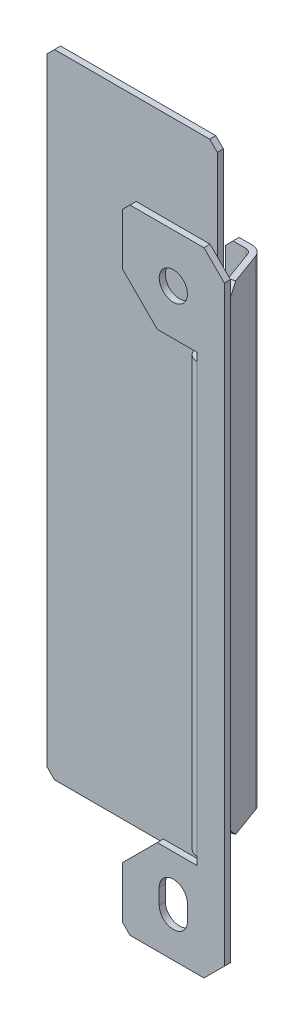
from build123d import *

# Parameters (mm, degrees)
BOSS_EXTRUDE1_DEPTH            = 62
CONVERT_SOLID1_DEPTH           = 62
CONVERT_SOLID1_2_DEPTH         = 62
CUT_EXTRUDE2_DEPTH             = 79.552402891
SKETCH9_W                      = 18.8
SKETCH9_H                      = 20
CUT_EXTRUDE3_DEPTH             = 79.552402891
BOSS_EXTRUDE3_DEPTH            = 1.2
BOSS_EXTRUDE4_DEPTH            = 20
CUT_EXTRUDE4_DEPTH             = 20.58
CUT_EXTRUDE4_DIRECTION_2_REACH = 81.822
CHAMFER4_SIZE                  = 4
CHAMFER1_SIZE                  = 1.5
SKETCH7_R                      = 2.7686
CUT_EXTRUDE1_DEPTH             = 1.2


# Read off the part's stored shape, not the designer's step: Convert-Solid1
with BuildPart() as part:
    # Sketch2 → Boss-Extrude1 (new body)
    with BuildSketch(Plane(origin=(0, 0, 0), x_dir=(1, 0, 0), z_dir=(0, 1, 0))):
        Polygon((10, 0), (3, 0), (-3.915434451, 19), (-43.8, 19), (-43.8, 40), (10, 40), align=None)
    extrude(amount=BOSS_EXTRUDE1_DEPTH)

    # Convert-Solid1 outline → Convert-Solid1 (cut)
    with BuildSketch(Plane(origin=(0, 0, 0), x_dir=(1, 0, 0), z_dir=(0, 1, 0))):
        with BuildLine():
            ThreePointArc((4.680498092, 0), (3.303914645, 0.434035094), (2.425235802, 1.579151656))
            Line((2.425235802, 1.579151656), (3, 0))
            Line((3, 0), (4.680498092, 0))
        make_face()
        with BuildLine():
            Line((-43.8, 40), (-43.8, 20.2))
            Line((-43.8, 20.2), (-4.755683497, 20.2))
            ThreePointArc((-4.755683497, 20.2), (-3.37910005, 19.765964906), (-2.500421207, 18.620848344))
            Line((-2.500421207, 18.620848344), (3.552866947, 1.989575828))
            ThreePointArc((3.552866947, 1.989575828), (3.992206368, 1.417017547), (4.680498092, 1.2))
            Line((4.680498092, 1.2), (10, 1.2))
            Line((10, 1.2), (10, 40))
            Line((10, 40), (-43.8, 40))
        make_face()
    extrude(amount=CONVERT_SOLID1_DEPTH, mode=Mode.SUBTRACT)

    # Convert-Solid1 2 outline → Convert-Solid1 2 (add)
    with BuildSketch(Plane(origin=(0, 0, 0), x_dir=(1, 0, 0), z_dir=(0, 1, 0))):
        with BuildLine():
            ThreePointArc((-4.755683497, 19), (-4.067391773, 18.782982453), (-3.628052352, 18.210424172))
            Line((-3.628052352, 18.210424172), (-3.915434451, 19))
            Line((-3.915434451, 19), (-4.755683497, 19))
        make_face()
    extrude(amount=CONVERT_SOLID1_2_DEPTH)

    # Sketch8 → Cut-Extrude2 (cut, through all)
    with BuildSketch(Plane.XY):
        Polygon((-8.8, 35), (-10.3748, 34.347696482), (-10.3748, -34.347696482), (-8.8, -35), align=None)
        Polygon((-8.8, 35.5), (-10.3748, 36.152303518), (-10.3748, 75), (-8.8, 75), align=None)
        Polygon((-10.3748, -36.152303518), (-10.3748, -75), (-8.8, -75), (-8.8, -35.5), align=None)
    extrude(amount=-CUT_EXTRUDE2_DEPTH, mode=Mode.SUBTRACT)

    # Sketch9 → Cut-Extrude3 (cut, through all)
    with BuildSketch(Plane.XY):
        with Locations((0.6, 52)):
            Rectangle(SKETCH9_W, SKETCH9_H)
    extrude(amount=-CUT_EXTRUDE3_DEPTH, mode=Mode.SUBTRACT)

    # Sketch11 → Boss-Extrude3 (add)
    with BuildSketch(Plane.XY):
        Polygon((-3.1496, 43.5748), (4.680498092, 43.5748), (4.680498092, 42), (10, 42), (10, 62), (-10, 62), (-10, 50.4252), align=None)
    extrude(amount=-BOSS_EXTRUDE3_DEPTH)

    # Sketch12 → Boss-Extrude4 (add)
    with BuildSketch(Plane(origin=(0, 42, 0), x_dir=(1, 0, 0), z_dir=(0, 1, 0))):
        with BuildLine():
            Line((-3.628052352, 18.210424172), (0.305179296, 7.403959033))
            Line((0.305179296, 7.403959033), (1.432810441, 7.814383205))
            Line((1.432810441, 7.814383205), (-2.500421207, 18.620848344))
            ThreePointArc((-2.500421207, 18.620848344), (-3.37910005, 19.765964906), (-4.755683497, 20.2))
            Line((-4.755683497, 20.2), (-8.8, 20.2))
            Line((-8.8, 20.2), (-8.8, 19))
            Line((-8.8, 19), (-4.755683497, 19))
            ThreePointArc((-4.755683497, 19), (-4.067391773, 18.782982453), (-3.628052352, 18.210424172))
        make_face()
    extrude(amount=BOSS_EXTRUDE4_DEPTH)

    # Sketch13 → Cut-Extrude4 (cut)
    with BuildSketch(Plane(origin=(2.649066665, 0, -0.964181415), x_dir=(0.34202014332566943, 0, 0.9396926207859082), z_dir=(-0.9396926207859082, 0, 0.34202014332566943))):
        Polygon((-6.853068201, 42), (-11.853068201, 47), (-26.853068201, 47), (-26.853068201, 62), (-6.853068201, 62), align=None)
    extrude(amount=-CUT_EXTRUDE4_DEPTH, mode=Mode.SUBTRACT)

    # Cut-Extrude4 direction 2: up to this plane
    cut_extrude4_direction_2_end = Plane(origin=(-8.8, 35.5, -20.2), z_dir=(1, 0, 0))
    # Sketch13 → Cut-Extrude4 direction 2 (cut, up to the surface)
    with BuildSketch(Plane(origin=(2.649066665, 0, -0.964181415), x_dir=(0.34202014332566943, 0, 0.9396926207859082), z_dir=(-0.9396926207859082, 0, 0.34202014332566943)), mode=Mode.PRIVATE) as cut_extrude4_direction_2_sk1:
        Polygon((-6.853068201, 42), (-11.853068201, 47), (-26.853068201, 47), (-26.853068201, 62), (-6.853068201, 62), align=None)
    cut_extrude4_direction_2_tool1 = split(extrude(cut_extrude4_direction_2_sk1.sketch, amount=CUT_EXTRUDE4_DIRECTION_2_REACH, mode=Mode.PRIVATE), bisect_by=cut_extrude4_direction_2_end, keep=Keep.BOTH, mode=Mode.PRIVATE)
    add(cut_extrude4_direction_2_tool1.solids().sort_by_distance((-3.001015, 54.133333, -16.487654))[0], mode=Mode.SUBTRACT)

    # Chamfer4
    chamfer4_edges = [part.edges().sort_by_distance(p)[0] for p in [
        (10, 62, -0.6),
    ]]
    chamfer(chamfer4_edges, length=CHAMFER4_SIZE)

    # Chamfer1
    chamfer1_edges = [part.edges().sort_by_distance(p)[0] for p in [
        (-10, 62, -0.6),
        (-8.8, 47, -19.6),
        (-43.8, 62, -19.6),
        (-10.3748, 62, -19.6),
    ]]
    chamfer(chamfer1_edges, length=CHAMFER1_SIZE)

    # Mirror1: part across plane


with BuildPart() as part_1:
    add(part.part)
    add(part.part.mirror(Plane(origin=(10, 0, 0), x_dir=(0, 0, 1), z_dir=(0, 1, 0))))

    # Sketch7 → Cut-Extrude1 (cut)
    with BuildSketch(Plane.XY):
        with Locations((0, 52.5)):
            Circle(SKETCH7_R)
        with BuildLine():
            Line((-2.7686, -54), (-2.7686, -51))
            ThreePointArc((-2.7686, -51), (0, -48.2314), (2.7686, -51))
            Line((2.7686, -51), (2.7686, -54))
            ThreePointArc((2.7686, -54), (0, -56.7686), (-2.7686, -54))
        make_face()
    extrude(amount=-CUT_EXTRUDE1_DEPTH, mode=Mode.SUBTRACT)


solid = part_1.part
